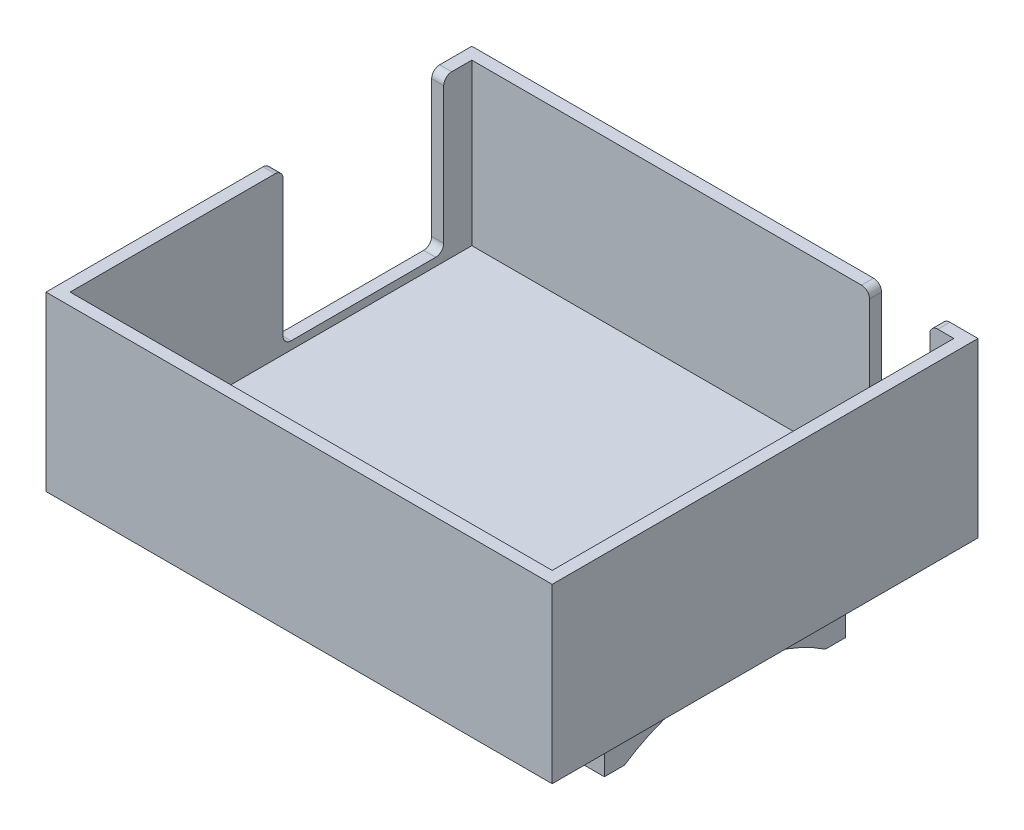
from build123d import *

# Parameters (mm, degrees)
SKETCH1_W           = 126
SKETCH1_H           = 106
SKETCH1_W_2         = 120
SKETCH1_H_2         = 100
BOSS_EXTRUDE1_DEPTH = 40
SKETCH5_W           = 126
SKETCH5_H           = 106
BOSS_EXTRUDE3_DEPTH = 3
SKETCH6_W           = 40
SKETCH6_H           = 60
BOSS_EXTRUDE4_DEPTH = 15
CUT_EXTRUDE3_DEPTH  = 92
SKETCH9_W           = 5
SKETCH9_H           = 3
CUT_EXTRUDE4_DEPTH  = 92
FILLET2_SIZE        = 15
FILLET2_SIZE_2      = 20
FILLET3_R           = 3
LPATTERN2_START     = -47
LPATTERN2_DEPTH     = 40
LPATTERN2_START_2   = -50
LPATTERN2_2_DEPTH   = 18
LPATTERN2_START_3   = -22
LPATTERN2_3_DEPTH   = 18
LPATTERN2_START_4   = -34
LPATTERN2_4_DEPTH   = 68
SKETCH10_W          = 15
SKETCH10_H          = 38
CUT_EXTRUDE5_DEPTH  = 10
SKETCH11_W          = 40
SKETCH11_H          = 38
CUT_EXTRUDE6_DEPTH  = 10
FILLET4_R           = 2


with BuildPart() as part:
    # Sketch1 → Boss-Extrude1 (new body)
    with BuildSketch(Plane(origin=(0, 0, 0), x_dir=(1, 0, 0), z_dir=(0, 1, 0))):
        Rectangle(SKETCH1_W, SKETCH1_H)
        Rectangle(SKETCH1_W_2, SKETCH1_H_2, mode=Mode.SUBTRACT)
    extrude(amount=BOSS_EXTRUDE1_DEPTH)

    # Sketch5 → Boss-Extrude3 (add)
    with BuildSketch(Plane.XZ):
        Rectangle(SKETCH5_W, SKETCH5_H)
    extrude(amount=BOSS_EXTRUDE3_DEPTH)

    # Sketch6 → Boss-Extrude4 (add)
    with BuildSketch(Plane.XZ.offset(3)):
        with Locations((33, 0)):
            Rectangle(SKETCH6_W, SKETCH6_H)
    extrude(amount=BOSS_EXTRUDE4_DEPTH)

    # Sketch7 → Cut-Extrude3 (cut)
    with BuildSketch(Plane(origin=(53, 0, 0), x_dir=(0, 0, -1), z_dir=(1, 0, 0))):
        with BuildLine():
            Line((-25, -18), (25, -18))
            ThreePointArc((25, -18), (0, -10.416573868), (-25, -18))
        make_face()
    extrude(amount=-CUT_EXTRUDE3_DEPTH, mode=Mode.SUBTRACT)

    # Sketch9 → Cut-Extrude4 (cut)
    with BuildSketch(Plane.XY.offset(30)):
        with Locations((30.5, -4.5)):
            Rectangle(SKETCH9_W, SKETCH9_H)
        with Locations((35.5, -4.5)):
            Rectangle(SKETCH9_W, SKETCH9_H)
    extrude(amount=-CUT_EXTRUDE4_DEPTH, mode=Mode.SUBTRACT)

    # Fillet2
    # a fillet whose section is not a circle: 20, 15 mm, written as the material it takes off along each edge
    with BuildSketch(Plane(origin=(38, -6, -30), x_dir=(0, 0, 1), z_dir=(-1, 0, 0))) as fillet2_piece_1:
        with BuildLine():
            Bezier((FILLET2_SIZE, 0), (0, 0), (0, -FILLET2_SIZE_2), weights=[1, 1.5, 1])
            Line((0, -FILLET2_SIZE_2), (0, 0))
            Line((0, 0), (FILLET2_SIZE, 0))
        make_face()
    extrude(amount=10, mode=Mode.SUBTRACT)
    with BuildSketch(Plane(origin=(28, -6, 30), x_dir=(0, 0, -1), z_dir=(1, 0, 0))) as fillet2_piece_2:
        with BuildLine():
            Bezier((FILLET2_SIZE_2, 0), (0, 0), (0, -FILLET2_SIZE), weights=[1, 1.5, 1])
            Line((0, -FILLET2_SIZE), (0, 0))
            Line((0, 0), (FILLET2_SIZE_2, 0))
        make_face()
    extrude(amount=10, mode=Mode.SUBTRACT)

    # Fillet3
    fillet3_edges = [part.edges().sort_by_distance(p)[0] for p in [
        (53, -3, 0),
        (45.5, -3, 30),
        (13, -3, 0),
        (20.5, -3, -30),
        (45.5, -3, -30),
        (20.5, -3, 30),
    ]]
    fillet(fillet3_edges, radius=FILLET3_R)



with BuildPart() as body_2:
    # LPattern2: read off the stored shape, not the designer's step
    # LPattern2 outline → LPattern2 (new body)
    with BuildSketch(Plane.YZ.offset(LPATTERN2_START)):
        with BuildLine():
            Line((-6, -15), (-6, 10))
            add(Edge.make_bspline(
                [(-6, 10), (-6, 28.973665961), (-18, 29.894663844)],
                knots=[0, 0, 0, 0.924950591, 0.924950591, 0.924950591], degree=2, weights=[1, 1.462475296, 1.069416995]))
            Line((-18, 29.894663844), (-18, 25))
            ThreePointArc((-18, 25), (-10.416573868, 0), (-18, -25))
            Line((-18, -25), (-18, -29.611278447))
            add(Edge.make_bspline(
                [(-18, -29.611278447), (-6, -28.174650985), (-6, -15)],
                knots=[0.172065577, 0.172065577, 0.172065577, 1, 1, 1], degree=2, weights=[1.142459014, 1.413967211, 1]))
        make_face()
    extrude(amount=LPATTERN2_DEPTH)


with BuildPart() as part_1:
    add(part.part)

    add(body_2.part)  # LPattern2 2 merges body 2
    # LPattern2 2 outline → LPattern2 2 (add)
    with BuildSketch(Plane.YZ.offset(LPATTERN2_START_2)):
        with BuildLine():
            ThreePointArc((-3, 33), (-3.878679656, 30.878679656), (-6, 30))
            Line((-6, 30), (-18, 30))
            Line((-18, 30), (-18, 29.894663844))
            add(Edge.make_bspline(
                [(-6, 10), (-6, 28.973665961), (-18, 29.894663844)],
                knots=[0, 0, 0, 0.924950591, 0.924950591, 0.924950591], degree=2, weights=[1, 1.462475296, 1.069416995]))
            Line((-6, 10), (-6, -15))
            add(Edge.make_bspline(
                [(-18, -29.611278447), (-6, -28.174650985), (-6, -15)],
                knots=[0.172065577, 0.172065577, 0.172065577, 1, 1, 1], degree=2, weights=[1.142459014, 1.413967211, 1]))
            Line((-18, -29.611278447), (-18, -30))
            Line((-18, -30), (-6, -30))
            ThreePointArc((-6, -30), (-3.878679656, -30.878679656), (-3, -33))
            Line((-3, -33), (-3, 33))
        make_face()
    extrude(amount=LPATTERN2_2_DEPTH)

    # LPattern2 3 outline → LPattern2 3 (add)
    with BuildSketch(Plane.YZ.offset(LPATTERN2_START_3)):
        with BuildLine():
            ThreePointArc((-3, 33), (-3.878679656, 30.878679656), (-6, 30))
            Line((-6, 30), (-18, 30))
            Line((-18, 30), (-18, 29.894663844))
            add(Edge.make_bspline(
                [(-6, 10), (-6, 28.973665961), (-18, 29.894663844)],
                knots=[0, 0, 0, 0.924950591, 0.924950591, 0.924950591], degree=2, weights=[1, 1.462475296, 1.069416995]))
            Line((-6, 10), (-6, -15))
            add(Edge.make_bspline(
                [(-18, -29.611278447), (-6, -28.174650985), (-6, -15)],
                knots=[0.172065577, 0.172065577, 0.172065577, 1, 1, 1], degree=2, weights=[1.142459014, 1.413967211, 1]))
            Line((-18, -29.611278447), (-18, -30))
            Line((-18, -30), (-6, -30))
            ThreePointArc((-6, -30), (-3.878679656, -30.878679656), (-3, -33))
            Line((-3, -33), (-3, 33))
        make_face()
    extrude(amount=LPATTERN2_3_DEPTH)

    # LPattern2 4 outline → LPattern2 4 (cut)
    with BuildSketch(Plane.XY.offset(LPATTERN2_START_4)):
        with BuildLine():
            Line((-50, -18), (-47, -18))
            Line((-47, -18), (-47, -6))
            ThreePointArc((-47, -6), (-47.878679656, -3.878679656), (-50, -3))
            Line((-50, -3), (-50, -18))
        make_face()
        with BuildLine():
            Line((-4, -18), (-4, -3))
            ThreePointArc((-4, -3), (-6.121320344, -3.878679656), (-7, -6))
            Line((-7, -6), (-7, -18))
            Line((-7, -18), (-4, -18))
        make_face()
    extrude(amount=LPATTERN2_4_DEPTH, mode=Mode.SUBTRACT)

    # Sketch10 → Cut-Extrude5 (cut)
    with BuildSketch(Plane(origin=(0, 0, -53), x_dir=(-1, 0, 0), z_dir=(0, 0, -1))):
        with Locations((-46.5, 21)):
            Rectangle(SKETCH10_W, SKETCH10_H)
    extrude(amount=-CUT_EXTRUDE5_DEPTH, mode=Mode.SUBTRACT)

    # Sketch11 → Cut-Extrude6 (cut)
    with BuildSketch(Plane.ZY.offset(63)):
        with Locations((-23, 21)):
            Rectangle(SKETCH11_W, SKETCH11_H)
    extrude(amount=-CUT_EXTRUDE6_DEPTH, mode=Mode.SUBTRACT)

    # Fillet4
    fillet4_edges = [part_1.edges().sort_by_distance(p)[0] for p in [
        (39, 40, -51.5),
        (54, 40, -51.5),
        (39, 2, -51.5),
        (54, 2, -51.5),
        (-61.5, 40, -3),
        (-61.5, 40, -43),
        (-61.5, 2, -3),
        (-61.5, 2, -43),
    ]]
    fillet(fillet4_edges, radius=FILLET4_R)


solid = part_1.part
